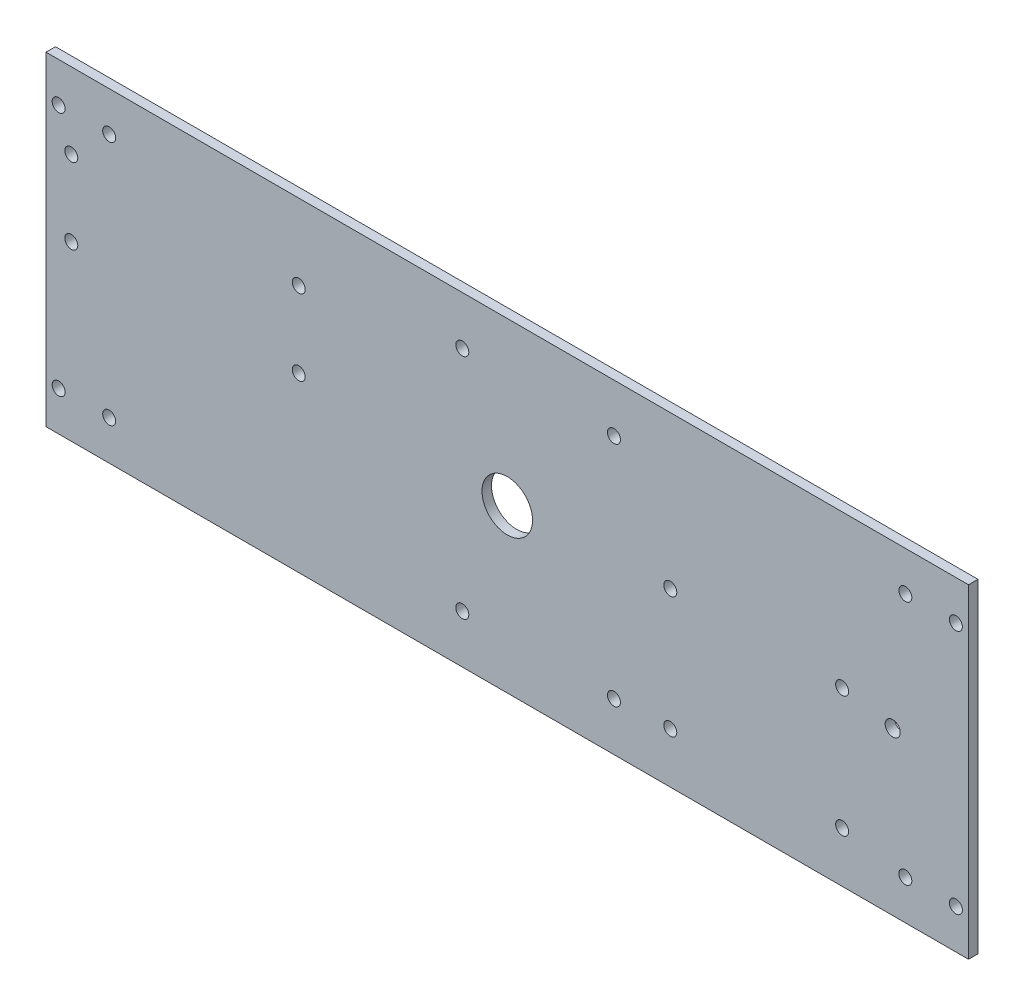
from build123d import *

# Parameters (mm, degrees)
SKETCH1_W                      = 231.775
SKETCH1_H                      = 81.4959
BOSS_EXTRUDE1_DEPTH            = 2.38125
F_4_CLEARANCE_HOLE1_D          = 3.2639
F_4_CLEARANCE_HOLE2_AT_2_COUNT = 2
F_4_CLEARANCE_HOLE2_AT_2_PITCH = 12.7
F_1_2_0_5_DIAMETER_HOLE1_D     = 12.7
F_4_CLEARANCE_HOLE3_D          = 3.2639
F_6_CLEARANCE_HOLE1_D          = 3.7973


with BuildPart() as part:
    # Sketch1 → Boss-Extrude1 (new body)
    with BuildSketch(Plane.XY):
        Rectangle(SKETCH1_W, SKETCH1_H)
    extrude(amount=BOSS_EXTRUDE1_DEPTH)

    # #4 Clearance Hole1 (through all)
    with Locations(Plane.XY.offset(2.38125)):
        with Locations((-11.29792, 28.575), (26.80208, 28.575)):
            f_4_clearance_hole1 = Hole(F_4_CLEARANCE_HOLE1_D / 2)

    # Mirror1: #4 Clearance Hole1 across plane
    add(f_4_clearance_hole1.mirror(Plane.ZX), mode=Mode.SUBTRACT)

    # Sketch6 → #4 Clearance Hole2 (revolve, cut)
    with BuildSketch(Plane(origin=(-112.7125, 30.82036, 2.38125), x_dir=(0, -1, 0), z_dir=(1, 0, 0))):
        Polygon((0, 0), (0, 10.505574487), (1.63195, 9.525), (1.63195, 0), align=None)
    f_4_clearance_hole2 = revolve(axis=Axis((-112.7125, 30.82036, 8.73125), (0, 0, -1)), mode=Mode.SUBTRACT)

    # #4 Clearance Hole2 at 2: #4 Clearance Hole2 ×2
    with Locations(*[(i * F_4_CLEARANCE_HOLE2_AT_2_PITCH, 0, 0) for i in range(1, F_4_CLEARANCE_HOLE2_AT_2_COUNT)]):
        add(f_4_clearance_hole2, mode=Mode.SUBTRACT)

    # Mirror2: #4 Clearance Hole2 across plane
    add(f_4_clearance_hole2.mirror(Plane(origin=(0, 0, 0), x_dir=(0, 0, 1), z_dir=(1, 0, 0))), mode=Mode.SUBTRACT)

    # Mirror2 copy 1 sketch → Mirror2 copy 1 (revolve, cut)
    with BuildSketch(Plane(origin=(100.0125, 30.82036, 2.38125), x_dir=(0, -1, 0), z_dir=(-1, 0, 0))):
        Polygon((0, 0), (0, -10.505574487), (1.63195, -9.525), (1.63195, 0), align=None)
    revolve(axis=Axis((100.0125, 30.82036, 8.73125), (0, 0, 1)), mode=Mode.SUBTRACT)

    # Mirror3 copy 1 sketch → Mirror3 copy 1 (revolve, cut)
    with BuildSketch(Plane(origin=(112.7125, -30.82036, 2.38125), x_dir=(0, 1, 0), z_dir=(-1, 0, 0))):
        Polygon((0, 0), (0, 10.505574487), (1.63195, 9.525), (1.63195, 0), align=None)
    revolve(axis=Axis((112.7125, -30.82036, 8.73125), (0, 0, -1)), mode=Mode.SUBTRACT)

    # Mirror3 copy 2 sketch → Mirror3 copy 2 (revolve, cut)
    with BuildSketch(Plane(origin=(100.0125, -30.82036, 2.38125), x_dir=(0, 1, 0), z_dir=(-1, 0, 0))):
        Polygon((0, 0), (0, 10.505574487), (1.63195, 9.525), (1.63195, 0), align=None)
    revolve(axis=Axis((100.0125, -30.82036, 8.73125), (0, 0, -1)), mode=Mode.SUBTRACT)

    # Mirror3 copy 3 sketch → Mirror3 copy 3 (revolve, cut)
    with BuildSketch(Plane(origin=(-112.7125, -30.82036, 2.38125), x_dir=(0, 1, 0), z_dir=(1, 0, 0))):
        Polygon((0, 0), (0, -10.505574487), (1.63195, -9.525), (1.63195, 0), align=None)
    revolve(axis=Axis((-112.7125, -30.82036, 8.73125), (0, 0, 1)), mode=Mode.SUBTRACT)

    # Mirror3 copy 4 sketch → Mirror3 copy 4 (revolve, cut)
    with BuildSketch(Plane(origin=(-100.0125, -30.82036, 2.38125), x_dir=(0, 1, 0), z_dir=(1, 0, 0))):
        Polygon((0, 0), (0, -10.505574487), (1.63195, -9.525), (1.63195, 0), align=None)
    revolve(axis=Axis((-100.0125, -30.82036, 8.73125), (0, 0, 1)), mode=Mode.SUBTRACT)

    # 1/2 (0.5) Diameter Hole1 (through all)
    with Locations(Plane.XY.offset(2.38125)):
        with Locations((0, 0)):
            Hole(F_1_2_0_5_DIAMETER_HOLE1_D / 2)

    # #4 Clearance Hole3 (through all)
    with Locations(Plane.XY.offset(2.38125)):
        with Locations((-109.5375, 21.69795), (-109.5375, 2.64795), (-52.3875, 2.64795), (-52.3875, 21.69795), (40.9575, 2.43205), (84.1375, 2.43205), (84.1375, -28.04795), (40.9575, -28.04795)):
            Hole(F_4_CLEARANCE_HOLE3_D / 2)

    # #6 Clearance Hole1 (through all)
    with Locations(Plane.XY.offset(2.38125)):
        with Locations((96.8375, 0)):
            Hole(F_6_CLEARANCE_HOLE1_D / 2)


solid = part.part
